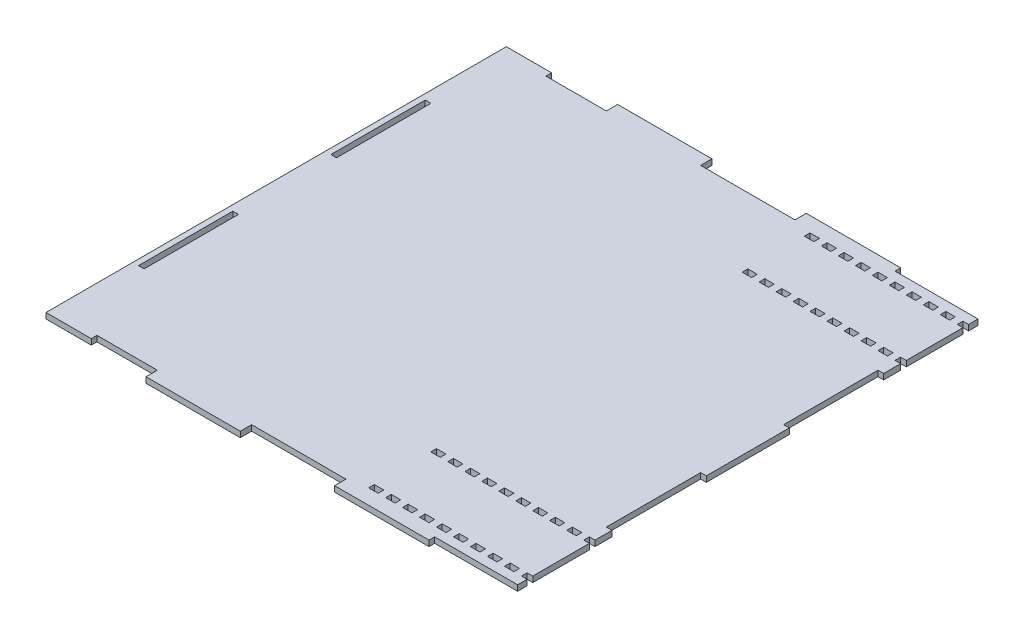
from build123d import *

# Parameters (mm, degrees)
SKETCH1_W           = 3
SKETCH1_H           = 50
SKETCH1_W_2         = 5
SKETCH1_H_2         = 3
BOSS_EXTRUDE1_DEPTH = 3


with BuildPart() as part:
    # Sketch1 → Boss-Extrude1 (new body)
    with BuildSketch(Plane(origin=(0, 0, 0), x_dir=(1, 0, 0), z_dir=(0, 1, 0))):
        Polygon((247, -244), (247, -239), (244, -239), (244, -236), (247, -236), (247, -206), (244, -206), (244, -203), (247, -203), (247, -194), (244, -194), (244, -144), (247, -144), (247, -100), (244, -100), (244, -50), (247, -50), (247, -41), (244, -41), (244, -38), (247, -38), (247, -8), (244, -8), (244, -5), (247, -5), (247, 0), (203, 0), (203, 3), (153, 3), (153, -3), (103, -3), (103, 3), (53, 3), (53, -3), (21, -3), (21, 0), (0, 0), (-3, 0), (-3, -244), (0, -244), (21, -244), (21, -241), (53, -241), (53, -247), (103, -247), (103, -241), (153, -241), (153, -247), (203, -247), (203, -244), align=None)
        with Locations((1.5, -173)):
            Rectangle(SKETCH1_W, SKETCH1_H, mode=Mode.SUBTRACT)
        with Locations((237.5, -6.5)):
            Rectangle(SKETCH1_W_2, SKETCH1_H_2, mode=Mode.SUBTRACT)
        with Locations((1.5, -71)):
            Rectangle(SKETCH1_W, SKETCH1_H, mode=Mode.SUBTRACT)
        with Locations((237.5, -39.5)):
            Rectangle(SKETCH1_W_2, SKETCH1_H_2, mode=Mode.SUBTRACT)
        with Locations((228.5, -6.5)):
            Rectangle(SKETCH1_W_2, SKETCH1_H_2, mode=Mode.SUBTRACT)
        with Locations((219.5, -6.5)):
            Rectangle(SKETCH1_W_2, SKETCH1_H_2, mode=Mode.SUBTRACT)
        with Locations((210.5, -6.5)):
            Rectangle(SKETCH1_W_2, SKETCH1_H_2, mode=Mode.SUBTRACT)
        with Locations((201.5, -6.5)):
            Rectangle(SKETCH1_W_2, SKETCH1_H_2, mode=Mode.SUBTRACT)
        with Locations((192.5, -6.5)):
            Rectangle(SKETCH1_W_2, SKETCH1_H_2, mode=Mode.SUBTRACT)
        with Locations((237.5, -237.5)):
            Rectangle(SKETCH1_W_2, SKETCH1_H_2, mode=Mode.SUBTRACT)
        with Locations((183.5, -6.5)):
            Rectangle(SKETCH1_W_2, SKETCH1_H_2, mode=Mode.SUBTRACT)
        with Locations((174.5, -6.5)):
            Rectangle(SKETCH1_W_2, SKETCH1_H_2, mode=Mode.SUBTRACT)
        with Locations((165.5, -6.5)):
            Rectangle(SKETCH1_W_2, SKETCH1_H_2, mode=Mode.SUBTRACT)
        with Locations((192.5, -237.5)):
            Rectangle(SKETCH1_W_2, SKETCH1_H_2, mode=Mode.SUBTRACT)
        with Locations((201.5, -237.5)):
            Rectangle(SKETCH1_W_2, SKETCH1_H_2, mode=Mode.SUBTRACT)
        with Locations((210.5, -237.5)):
            Rectangle(SKETCH1_W_2, SKETCH1_H_2, mode=Mode.SUBTRACT)
        with Locations((219.5, -237.5)):
            Rectangle(SKETCH1_W_2, SKETCH1_H_2, mode=Mode.SUBTRACT)
        with Locations((228.5, -237.5)):
            Rectangle(SKETCH1_W_2, SKETCH1_H_2, mode=Mode.SUBTRACT)
        with Locations((183.5, -237.5)):
            Rectangle(SKETCH1_W_2, SKETCH1_H_2, mode=Mode.SUBTRACT)
        with Locations((174.5, -237.5)):
            Rectangle(SKETCH1_W_2, SKETCH1_H_2, mode=Mode.SUBTRACT)
        with Locations((165.5, -237.5)):
            Rectangle(SKETCH1_W_2, SKETCH1_H_2, mode=Mode.SUBTRACT)
        with Locations((228.5, -39.5)):
            Rectangle(SKETCH1_W_2, SKETCH1_H_2, mode=Mode.SUBTRACT)
        with Locations((219.5, -39.5)):
            Rectangle(SKETCH1_W_2, SKETCH1_H_2, mode=Mode.SUBTRACT)
        with Locations((210.5, -39.5)):
            Rectangle(SKETCH1_W_2, SKETCH1_H_2, mode=Mode.SUBTRACT)
        with Locations((201.5, -39.5)):
            Rectangle(SKETCH1_W_2, SKETCH1_H_2, mode=Mode.SUBTRACT)
        with Locations((192.5, -39.5)):
            Rectangle(SKETCH1_W_2, SKETCH1_H_2, mode=Mode.SUBTRACT)
        with Locations((183.5, -39.5)):
            Rectangle(SKETCH1_W_2, SKETCH1_H_2, mode=Mode.SUBTRACT)
        with Locations((174.5, -39.5)):
            Rectangle(SKETCH1_W_2, SKETCH1_H_2, mode=Mode.SUBTRACT)
        with Locations((165.5, -39.5)):
            Rectangle(SKETCH1_W_2, SKETCH1_H_2, mode=Mode.SUBTRACT)
        with Locations((237.5, -204.5)):
            Rectangle(SKETCH1_W_2, SKETCH1_H_2, mode=Mode.SUBTRACT)
        with Locations((228.5, -204.5)):
            Rectangle(SKETCH1_W_2, SKETCH1_H_2, mode=Mode.SUBTRACT)
        with Locations((219.5, -204.5)):
            Rectangle(SKETCH1_W_2, SKETCH1_H_2, mode=Mode.SUBTRACT)
        with Locations((210.5, -204.5)):
            Rectangle(SKETCH1_W_2, SKETCH1_H_2, mode=Mode.SUBTRACT)
        with Locations((201.5, -204.5)):
            Rectangle(SKETCH1_W_2, SKETCH1_H_2, mode=Mode.SUBTRACT)
        with Locations((192.5, -204.5)):
            Rectangle(SKETCH1_W_2, SKETCH1_H_2, mode=Mode.SUBTRACT)
        with Locations((183.5, -204.5)):
            Rectangle(SKETCH1_W_2, SKETCH1_H_2, mode=Mode.SUBTRACT)
        with Locations((174.5, -204.5)):
            Rectangle(SKETCH1_W_2, SKETCH1_H_2, mode=Mode.SUBTRACT)
        with Locations((165.5, -204.5)):
            Rectangle(SKETCH1_W_2, SKETCH1_H_2, mode=Mode.SUBTRACT)
    extrude(amount=BOSS_EXTRUDE1_DEPTH)


solid = part.part
